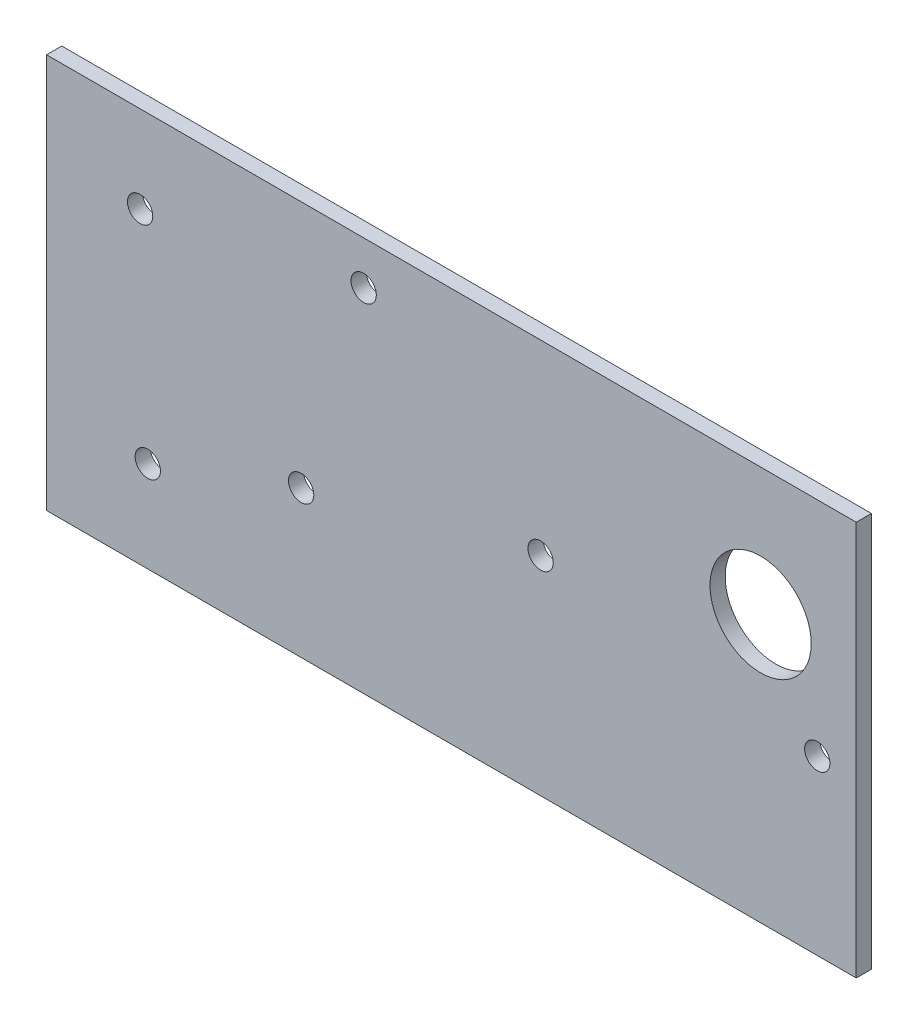
from build123d import *

# Parameters (mm, degrees)
SKETCH1_W           = 160
SKETCH1_H           = 78
SKETCH1_R           = 2.5
BOSS_EXTRUDE1_DEPTH = 3
SKETCH2_R           = 2.5
CUT_EXTRUDE1_DEPTH  = 3
SKETCH3_R           = 10
CUT_EXTRUDE2_DEPTH  = 3


with BuildPart() as part:
    # Sketch1 → Boss-Extrude1 (new body)
    with BuildSketch(Plane.XY):
        with Locations((60, 21)):
            Rectangle(SKETCH1_W, SKETCH1_H)
        Circle(SKETCH1_R, mode=Mode.SUBTRACT)
    extrude(amount=BOSS_EXTRUDE1_DEPTH)

    # Sketch2 → Cut-Extrude1 (cut)
    with BuildSketch(Plane.XY.offset(3)):
        with Locations((-1.514718133, 42.849954776)):
            Circle(SKETCH2_R)
        with Locations((30.30508702, 11.030149622)):
            Circle(SKETCH2_R)
        with Locations((42.658505122, 51.436359568)):
            Circle(SKETCH2_R)
        with Locations((77.630073388, 23.11694197)):
            Circle(SKETCH2_R)
        with Locations((121.096735571, 34.763799)):
            Circle(SKETCH2_R)
        with Locations((132.2988137, 16.12041021)):
            Circle(SKETCH2_R)
    extrude(amount=-CUT_EXTRUDE1_DEPTH, mode=Mode.SUBTRACT)

    # Sketch3 → Cut-Extrude2 (cut)
    with BuildSketch(Plane.XY.offset(3)):
        with Locations((121.096735571, 34.763799)):
            Circle(SKETCH3_R)
    extrude(amount=-CUT_EXTRUDE2_DEPTH, mode=Mode.SUBTRACT)


solid = part.part
